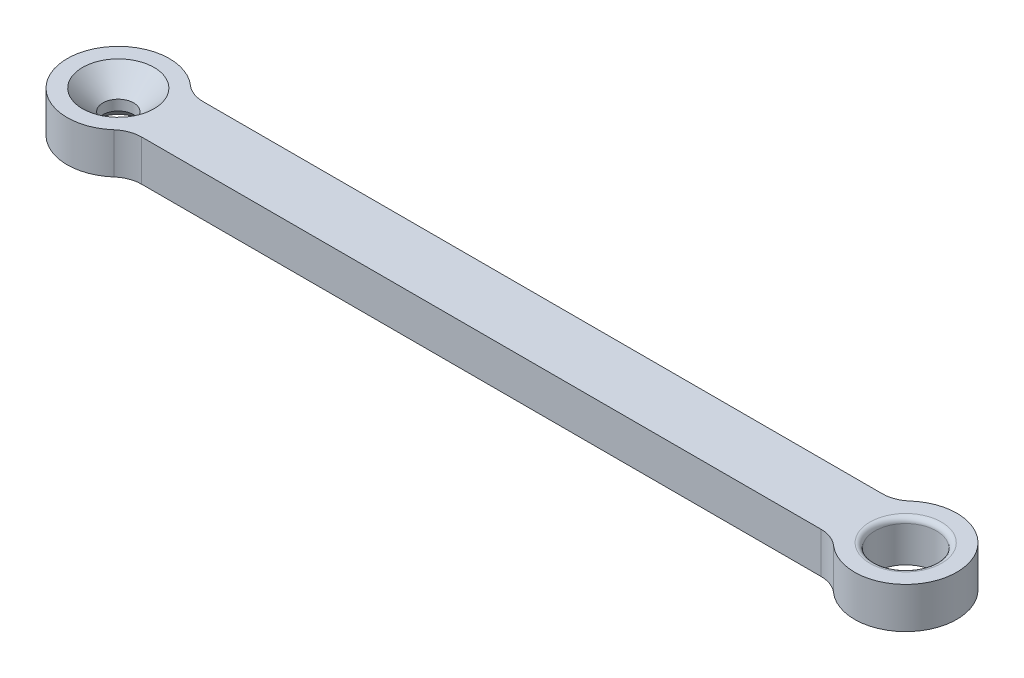
from build123d import *

# Parameters (mm, degrees)
SKETCH1_W                = 73.441671578
SKETCH1_H                = 6
BOSS_EXTRUDE1_DEPTH      = 4
SKETCH2_R                = 5
BOSS_EXTRUDE3_DEPTH      = 4
SKETCH3_R                = 5
BOSS_EXTRUDE4_DEPTH      = 4
FILLET1_R                = 3
FILLET3_R                = 3
F_3_0_3_DIAMETER_HOLE1_D = 3
F_6_0_6_DIAMETER_HOLE1_D = 6
CHAMFER1_SIZE            = 2
CHAMFER2_SIZE            = 1
FILLET4_R                = 0.5


with BuildPart() as part:
    # Sketch1 → Boss-Extrude1 (new body)
    with BuildSketch(Plane(origin=(0, 0, 0), x_dir=(1, 0, 0), z_dir=(0, 1, 0))):
        with Locations((1.782889385, 0)):
            Rectangle(SKETCH1_W, SKETCH1_H)
    extrude(amount=BOSS_EXTRUDE1_DEPTH)


with BuildPart() as body_2:
    # Sketch2 → Boss-Extrude3 (new body)
    with BuildSketch(Plane.XZ):
        with Locations(Location((38.5, 0, 0), (0, 0, 270))):
            Circle(SKETCH2_R)
    extrude(amount=-BOSS_EXTRUDE3_DEPTH)


with BuildPart() as body_3:
    # Sketch3 → Boss-Extrude4 (new body)
    with BuildSketch(Plane.XZ):
        with Locations(Location((-38.5, 0, 0), (0, 0, 270))):
            Circle(SKETCH3_R)
    extrude(amount=-BOSS_EXTRUDE4_DEPTH)


with BuildPart() as part_1:
    add(part.part)

    # Intersect3: read off the stored shape, not the designer's step
    # Intersect3: union body 3
    add(body_3.part)

    # Fillet1
    fillet1_edges = [part_1.edges().sort_by_distance(p)[0] for p in [
        (-34.5, 2, 3),
        (-34.5, 2, -3),
    ]]
    fillet(fillet1_edges, radius=FILLET1_R)

    # Intersect4: read off the stored shape, not the designer's step
    # Intersect4: union body 2
    add(body_2.part)

    # Fillet3
    fillet3_edges = [part_1.edges().sort_by_distance(p)[0] for p in [
        (34.5, 2, 3),
        (34.5, 2, -3),
    ]]
    fillet(fillet3_edges, radius=FILLET3_R)

    # Ø3.0 (3) Diameter Hole1 (through all)
    with Locations(Plane(origin=(0, 4, 0), x_dir=(1, 0, 0), z_dir=(0, 1, 0))):
        with Locations((-38.5, 0)):
            Hole(F_3_0_3_DIAMETER_HOLE1_D / 2)

    # Ø6.0 (6) Diameter Hole1 (through all)
    with Locations(Plane(origin=(0, 4, 0), x_dir=(1, 0, 0), z_dir=(0, 1, 0))):
        with Locations((38.5, 0)):
            Hole(F_6_0_6_DIAMETER_HOLE1_D / 2)

    # Chamfer1
    chamfer1_edges = [part_1.edges().sort_by_distance(p)[0] for p in [
        (-37, 4, 0),
    ]]
    chamfer(chamfer1_edges, length=CHAMFER1_SIZE)

    # Chamfer2
    chamfer2_edges = [part_1.edges().sort_by_distance(p)[0] for p in [
        (-37, 0, 0),
    ]]
    chamfer(chamfer2_edges, length=CHAMFER2_SIZE)

    # Fillet4
    fillet4_edges = [part_1.edges().sort_by_distance(p)[0] for p in [
        (41.5, 4, 0),
    ]]
    fillet(fillet4_edges, radius=FILLET4_R)


solid = part_1.part
